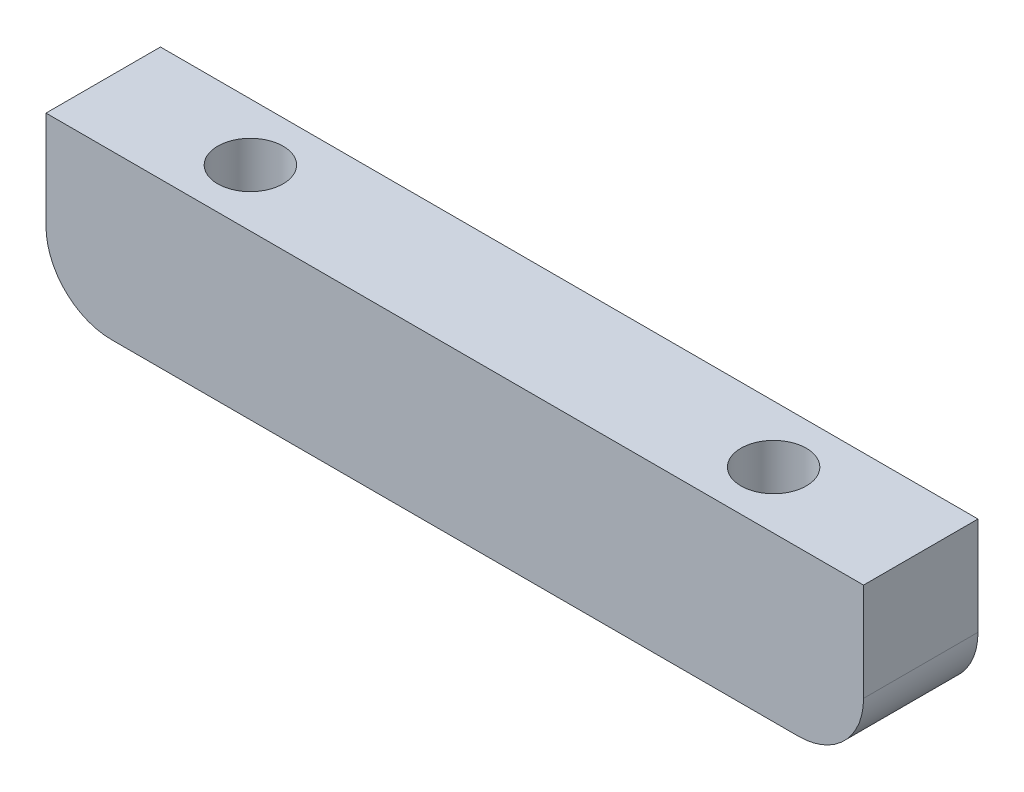
from build123d import *

# Parameters (mm, degrees)
SKETCH1_W           = 50
SKETCH1_H           = 7
BOSS_EXTRUDE1_DEPTH = 10
SKETCH2_R           = 2
CUT_EXTRUDE1_DEPTH  = 5
FILLET1_R           = 4


with BuildPart() as part:
    # Sketch1 → Boss-Extrude1 (new body)
    with BuildSketch(Plane(origin=(0, 0, 0), x_dir=(1, 0, 0), z_dir=(0, 1, 0))):
        Rectangle(SKETCH1_W, SKETCH1_H)
    extrude(amount=BOSS_EXTRUDE1_DEPTH)

    # Sketch2 → Cut-Extrude1 (cut)
    with BuildSketch(Plane(origin=(0, 10, 0), x_dir=(1, 0, 0), z_dir=(0, 1, 0))):
        with Locations((16, 0)):
            Circle(SKETCH2_R)
        with Locations((-16, 0)):
            Circle(SKETCH2_R)
    extrude(amount=-CUT_EXTRUDE1_DEPTH, mode=Mode.SUBTRACT)

    # Fillet1
    fillet1_edges = [part.edges().sort_by_distance(p)[0] for p in [
        (-25, 0, 0),
        (25, 0, 0),
    ]]
    fillet(fillet1_edges, radius=FILLET1_R)


solid = part.part
